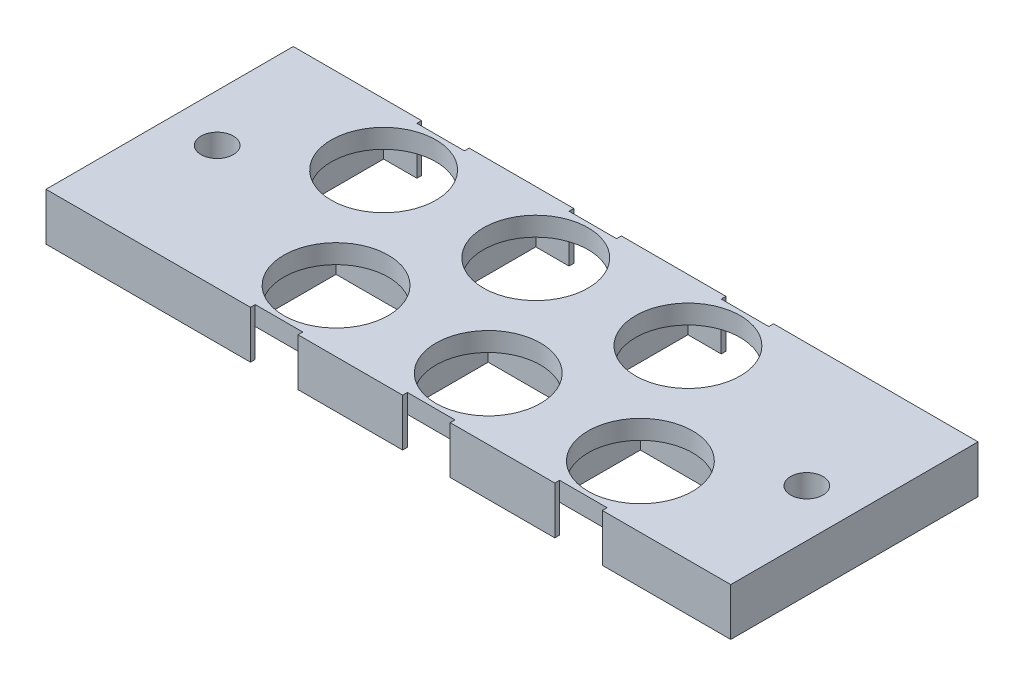
from build123d import *

# Parameters (mm, degrees)
SKETCH1_R             = 5.5
BOSS_EXTRUDE1_DEPTH   = 2
BOSS_EXTRUDE1_2_DEPTH = 2
BOSS_EXTRUDE1_3_DEPTH = 2
BOSS_EXTRUDE1_4_DEPTH = 2
BOSS_EXTRUDE1_5_DEPTH = 2
BOSS_EXTRUDE1_6_DEPTH = 2
SKETCH1_3_R           = 1.7
BOSS_EXTRUDE2_DEPTH   = 5
CUT_EXTRUDE1_DEPTH    = 1


with BuildPart() as part:
    # Sketch1 → Boss-Extrude1 (new body)
    with BuildSketch(Plane(origin=(0, 0, 0), x_dir=(1, 0, 0), z_dir=(0, 1, 0))):
        Polygon((2.68639507, -4.66487452), (-9.31360493, -4.664874562), (-9.313604887, -16.664874562), (2.686395113, -16.66487452), align=None)
        with Locations((-3.313604908, -10.664874541)):
            Circle(SKETCH1_R, mode=Mode.SUBTRACT)
    extrude(amount=-BOSS_EXTRUDE1_DEPTH)



with BuildPart() as body_2:
    # Sketch1 → Boss-Extrude1 2 (new body)
    with BuildSketch(Plane(origin=(0, 0, 0), x_dir=(1, 0, 0), z_dir=(0, 1, 0))):
        Polygon((18.68639507, -4.664873819), (6.68639507, -4.664873862), (6.686395113, -16.664873862), (18.686395113, -16.664873819), align=None)
        with Locations((12.686395092, -10.66487384)):
            Circle(SKETCH1_R, mode=Mode.SUBTRACT)
    extrude(amount=-BOSS_EXTRUDE1_2_DEPTH)


with BuildPart() as body_3:
    # Sketch1 → Boss-Extrude1 3 (new body)
    with BuildSketch(Plane(origin=(0, 0, 0), x_dir=(1, 0, 0), z_dir=(0, 1, 0))):
        Polygon((-1.313604837, -29.664873456), (10.686395163, -29.664873413), (10.68639512, -17.664873413), (-1.31360488, -17.664873456), align=None)
        with Locations((4.686395141, -23.664873434)):
            Circle(SKETCH1_R, mode=Mode.SUBTRACT)
    extrude(amount=-BOSS_EXTRUDE1_3_DEPTH)


with BuildPart() as body_4:
    # Sketch1 → Boss-Extrude1 4 (new body)
    with BuildSketch(Plane(origin=(0, 0, 0), x_dir=(1, 0, 0), z_dir=(0, 1, 0))):
        Polygon((14.686395163, -29.664873833), (26.686395163, -29.664873791), (26.68639512, -17.664873791), (14.68639512, -17.664873833), align=None)
        with Locations((20.686395141, -23.664873812)):
            Circle(SKETCH1_R, mode=Mode.SUBTRACT)
    extrude(amount=-BOSS_EXTRUDE1_4_DEPTH)


with BuildPart() as body_5:
    # Sketch1 → Boss-Extrude1 5 (new body)
    with BuildSketch(Plane(origin=(0, 0, 0), x_dir=(1, 0, 0), z_dir=(0, 1, 0))):
        Polygon((34.68639507, -4.664873762), (22.68639507, -4.664873805), (22.686395113, -16.664873805), (34.686395113, -16.664873762), align=None)
        with Locations((28.686395092, -10.664873784)):
            Circle(SKETCH1_R, mode=Mode.SUBTRACT)
    extrude(amount=-BOSS_EXTRUDE1_5_DEPTH)


with BuildPart() as body_6:
    # Sketch1 → Boss-Extrude1 6 (new body)
    with BuildSketch(Plane(origin=(0, 0, 0), x_dir=(1, 0, 0), z_dir=(0, 1, 0))):
        Polygon((30.686395163, -29.664873979), (42.686395163, -29.664873936), (42.68639512, -17.664873936), (30.68639512, -17.664873979), align=None)
        with Locations((36.686395141, -23.664873958)):
            Circle(SKETCH1_R, mode=Mode.SUBTRACT)
    extrude(amount=-BOSS_EXTRUDE1_6_DEPTH)


with BuildPart() as part_1:
    add(part.part)

    add(body_2.part)  # Boss-Extrude2 merges body 2

    add(body_3.part)  # Boss-Extrude2 merges body 3

    add(body_4.part)  # Boss-Extrude2 merges body 4

    add(body_5.part)  # Boss-Extrude2 merges body 5

    add(body_6.part)  # Boss-Extrude2 merges body 6
    # Sketch1<3> → Boss-Extrude2 (add)
    with BuildSketch(Plane(origin=(0, 0, 0), x_dir=(1, 0, 0), z_dir=(0, 1, 0))):
        Polygon((6.186395002, -4.164873846), (3.186395002, -4.1648745), (-0.813604931, -4.164874532), (-0.81360493, -4.664874532), (2.68639507, -4.66487452), (2.686395113, -16.66487452), (-9.313604887, -16.664874562), (-9.31360493, -4.664874562), (-5.81360493, -4.66487455), (-5.813604931, -4.16487455), (-9.813604931, -4.164874564), (-19.313604998, -4.164874546), (-19.313604998, -30.16487344), (-1.813604902, -30.16487344), (2.186395164, -30.164873443), (2.186395163, -29.664873443), (-1.313604837, -29.664873456), (-1.31360488, -17.664873456), (10.68639512, -17.664873413), (10.686395163, -29.664873413), (7.186395163, -29.664873425), (7.186395164, -30.164873425), (11.186395164, -30.164873411), (14.186395098, -30.164873817), (18.186395164, -30.164873821), (18.186395163, -29.664873821), (14.686395163, -29.664873833), (14.68639512, -17.664873833), (26.68639512, -17.664873791), (26.686395163, -29.664873791), (23.186395163, -29.664873803), (23.186395164, -30.164873803), (27.186395164, -30.164873789), (30.186395098, -30.164873963), (34.186395164, -30.164873966), (34.186395163, -29.664873966), (30.686395163, -29.664873979), (30.68639512, -17.664873979), (42.68639512, -17.664873936), (42.686395163, -29.664873936), (39.186395163, -29.664873949), (39.186395164, -30.164873949), (43.186395164, -30.164873935), (52.686395098, -30.16487344), (52.686395098, -4.164874546), (35.186395002, -4.164873743), (31.186395069, -4.164873775), (31.18639507, -4.664873775), (34.68639507, -4.664873762), (34.686395113, -16.664873762), (22.686395113, -16.664873805), (22.68639507, -4.664873805), (26.18639507, -4.664873793), (26.186395069, -4.164873793), (22.186395069, -4.164873807), (19.186395002, -4.1648738), (15.186395069, -4.164873832), (15.18639507, -4.664873832), (18.68639507, -4.664873819), (18.686395113, -16.664873819), (6.686395113, -16.664873862), (6.68639507, -4.664873862), (10.18639507, -4.664873849), (10.186395069, -4.164873849), align=None)
        with Locations((-14.313604998, -17.164873993)):
            Circle(SKETCH1_3_R, mode=Mode.SUBTRACT)
        with Locations((47.686395098, -17.164873993)):
            Circle(SKETCH1_3_R, mode=Mode.SUBTRACT)
    extrude(amount=-BOSS_EXTRUDE2_DEPTH)

    # Sketch2 → Cut-Extrude1 (cut)
    # profile 1 of 2: a face of its own
    with BuildSketch(Plane(origin=(0, -5, 0), x_dir=(-1, 0, 0), z_dir=(0, -1, 0))):
        Polygon((6.699801581, -23.2390136), (8.246596453, -23.2390136), (8.246596453, -23.564654626), (6.984737478, -23.564654626), (6.984737478, -24.541577703), (8.246596453, -24.541577703), (8.246596453, -24.867218728), (6.984737478, -24.867218728), (6.984737478, -26.4140136), (6.699801581, -26.4140136), align=None)
    # profile 2 of 2: a face of its own
    with BuildSketch(Plane(origin=(0, -5, 0), x_dir=(-1, 0, 0), z_dir=(0, -1, 0))):
        with BuildLine():
            Line((9.996916965, -23.157603344), (10.216979065, -23.329964121))
            Line((10.216979065, -23.329964121), (9.378071813, -24.612811677))
            add(Edge.make_bspline(
                [(9.378071813, -24.612811677), (9.43392485, -24.603909103), (9.542872514, -24.586543627), (9.65315015, -24.583678919), (9.706892927, -24.582282831)],
                knots=[0, 0, 0, 0, 1.025318673, 2, 2, 2, 2], degree=3))
            add(Edge.make_bspline(
                [(9.706892927, -24.582282831), (9.739163887, -24.583137599), (9.802478203, -24.584814619), (9.895509725, -24.598067595), (9.984924431, -24.618695779), (10.070522851, -24.64888638), (10.152413619, -24.68743998), (10.231065003, -24.733649384), (10.30499899, -24.789897237), (10.375167554, -24.852730491), (10.438873565, -24.922323744), (10.49527613, -24.996166388), (10.542653291, -25.074181472), (10.581092491, -25.156329486), (10.610941917, -25.2424838), (10.632702138, -25.332534184), (10.645565054, -25.426542733), (10.647311749, -25.490476506), (10.648199017, -25.522952903)],
                knots=[0, 0, 0, 0, 1.044136307, 2.048553127, 3.035567123, 4.010001674, 4.980053131, 5.96154148, 6.956538004, 7.981742224, 9.006487041, 10.005615874, 10.984750588, 11.954802044, 12.935714515, 13.930994945, 14.949008866, 16, 16, 16, 16], degree=3))
            add(Edge.make_bspline(
                [(10.648199017, -25.522952903), (10.646908057, -25.567384491), (10.644367755, -25.654815343), (10.619055025, -25.782157069), (10.579721633, -25.903471565), (10.523499161, -26.016821942), (10.453665142, -26.122052845), (10.368504755, -26.215293946), (10.271038162, -26.298451765), (10.160832281, -26.36799027), (10.042229735, -26.42478018), (9.917631851, -26.465570078), (9.788248654, -26.49068294), (9.700433045, -26.493831272), (9.656011517, -26.495423856)],
                knots=[0, 0, 0, 0, 1.031375318, 2.029502543, 3.004789286, 3.987476834, 4.960371455, 5.9300674, 6.912260825, 7.929083631, 8.949397511, 9.960523116, 10.96833055, 12, 12, 12, 12], degree=3))
            add(Edge.make_bspline(
                [(9.656011517, -26.495423856), (9.613288081, -26.494037555), (9.528660436, -26.491291536), (9.404170686, -26.466829578), (9.284552092, -26.427180992), (9.170642725, -26.372558039), (9.065123312, -26.303562674), (8.970720913, -26.220502607), (8.887906232, -26.125153306), (8.818986397, -26.017529563), (8.764323119, -25.901877958), (8.723329401, -25.781284966), (8.699384238, -25.656189983), (8.69603819, -25.571389235), (8.694352863, -25.528677062)],
                knots=[0, 0, 0, 0, 1.012016664, 2.004627821, 2.994792927, 3.992885782, 4.990978636, 5.973936114, 6.964471063, 7.975201453, 8.993600317, 9.990122807, 10.98767138, 12, 12, 12, 12], degree=3))
            add(Edge.make_bspline(
                [(8.694352863, -25.528677062), (8.695424602, -25.495979475), (8.697612889, -25.429217252), (8.712892251, -25.328103455), (8.737443886, -25.224642831), (8.764939609, -25.136872955), (8.793991413, -25.064971432), (8.818169074, -25.007001837), (8.848262627, -24.947347149), (8.880351337, -24.883961779), (8.91732364, -24.818479279), (8.957524265, -24.749805236), (9.002064662, -24.679031831), (9.033288667, -24.631003882), (9.049250699, -24.606451501)],
                knots=[0, 0, 0, 0, 1.173818275, 2.396712641, 3.66331629, 4.989737886, 5.693666774, 6.447286557, 7.243889047, 8.091586357, 8.998013824, 9.943181721, 10.948533338, 12, 12, 12, 12], degree=3))
            Line((9.049250699, -24.606451501), (9.996916965, -23.157603344))
        make_face()
        with BuildLine():
            add(Edge.make_bspline(
                [(9.64710727, -24.907923856), (9.622921579, -24.908639019), (9.575469451, -24.910042162), (9.505937895, -24.917966716), (9.440309411, -24.932982832), (9.377830069, -24.952402516), (9.31916676, -24.978858553), (9.263592246, -25.010560401), (9.211746157, -25.048541998), (9.16388158, -25.091418934), (9.120507249, -25.138406483), (9.083148796, -25.188723076), (9.050925237, -25.241169384), (9.024725214, -25.296180139), (9.004323526, -25.353735218), (8.989565892, -25.413569669), (8.981352848, -25.476084793), (8.97998648, -25.518477849), (8.97928876, -25.540125379)],
                knots=[0, 0, 0, 0, 1.128956033, 2.215002439, 3.259141796, 4.2666399, 5.263148119, 6.255916712, 7.247353359, 8.256307737, 9.250603402, 10.226115518, 11.176314381, 12.118911324, 13.063945463, 14.021379252, 14.989639887, 16, 16, 16, 16], degree=3))
            add(Edge.make_bspline(
                [(8.97928876, -25.540125379), (8.97985696, -25.561579289), (8.980971114, -25.603647213), (8.991087861, -25.665640612), (9.006541115, -25.725298779), (9.029528474, -25.782314158), (9.056948579, -25.837555818), (9.093148409, -25.889022827), (9.133259351, -25.939841033), (9.181205419, -25.986106654), (9.232661612, -26.029156591), (9.28763556, -26.066785107), (9.344930667, -26.098976136), (9.405320457, -26.124204774), (9.467948134, -26.144909663), (9.533335493, -26.159479719), (9.601528012, -26.167717054), (9.647721485, -26.169085201), (9.67127594, -26.169782831)],
                knots=[0, 0, 0, 0, 0.989467248, 1.94019797, 2.891935182, 3.827694429, 4.772920941, 5.730924762, 6.725747692, 7.756678648, 8.79901574, 9.819492441, 10.826891316, 11.826466727, 12.835195252, 13.867842842, 14.912794438, 16, 16, 16, 16], degree=3))
            add(Edge.make_bspline(
                [(9.67127594, -26.169782831), (9.694830356, -26.169085146), (9.741023753, -26.167716892), (9.809216821, -26.159480335), (9.874602152, -26.144907404), (9.9372372, -26.124212963), (9.997599783, -26.09894576), (10.054844781, -26.066985375), (10.109298837, -26.028925183), (10.16078881, -25.986180223), (10.208535311, -25.939577707), (10.249608271, -25.889476459), (10.28469949, -25.837139854), (10.313214788, -25.782531768), (10.335948959, -25.725264304), (10.351480576, -25.665649848), (10.361576431, -25.603644795), (10.362693456, -25.561578473), (10.363263119, -25.540125379)],
                knots=[0, 0, 0, 0, 1.087397944, 2.132534446, 3.165364764, 4.174271784, 5.174024072, 6.181601208, 7.194203697, 8.236725232, 9.267838612, 10.269026844, 11.221737037, 12.171628256, 13.107553087, 14.05945871, 15.010357665, 16, 16, 16, 16], degree=3))
            add(Edge.make_bspline(
                [(10.363263119, -25.540125379), (10.362763924, -25.518449609), (10.361784167, -25.475907121), (10.350702565, -25.413597625), (10.335333378, -25.35343124), (10.31212604, -25.29578579), (10.28197527, -25.240889945), (10.245252874, -25.18846183), (10.202761835, -25.138117296), (10.153715725, -25.091298499), (10.100325283, -25.048806355), (10.043918117, -25.010417813), (9.98414317, -24.979153645), (9.922078942, -24.95231253), (9.856977887, -24.933290658), (9.789551091, -24.917919833), (9.719159645, -24.910108409), (9.671290808, -24.908657076), (9.64710727, -24.907923856)],
                knots=[0, 0, 0, 0, 0.978753431, 1.920974676, 2.853199117, 3.782215702, 4.721507756, 5.67862441, 6.671401678, 7.694929396, 8.738190014, 9.75360867, 10.774035531, 11.783329636, 12.805060902, 13.835252836, 14.906360638, 16, 16, 16, 16], degree=3))
        make_face(mode=Mode.SUBTRACT)
    extrude(amount=-CUT_EXTRUDE1_DEPTH, mode=Mode.SUBTRACT)


solid = part_1.part
